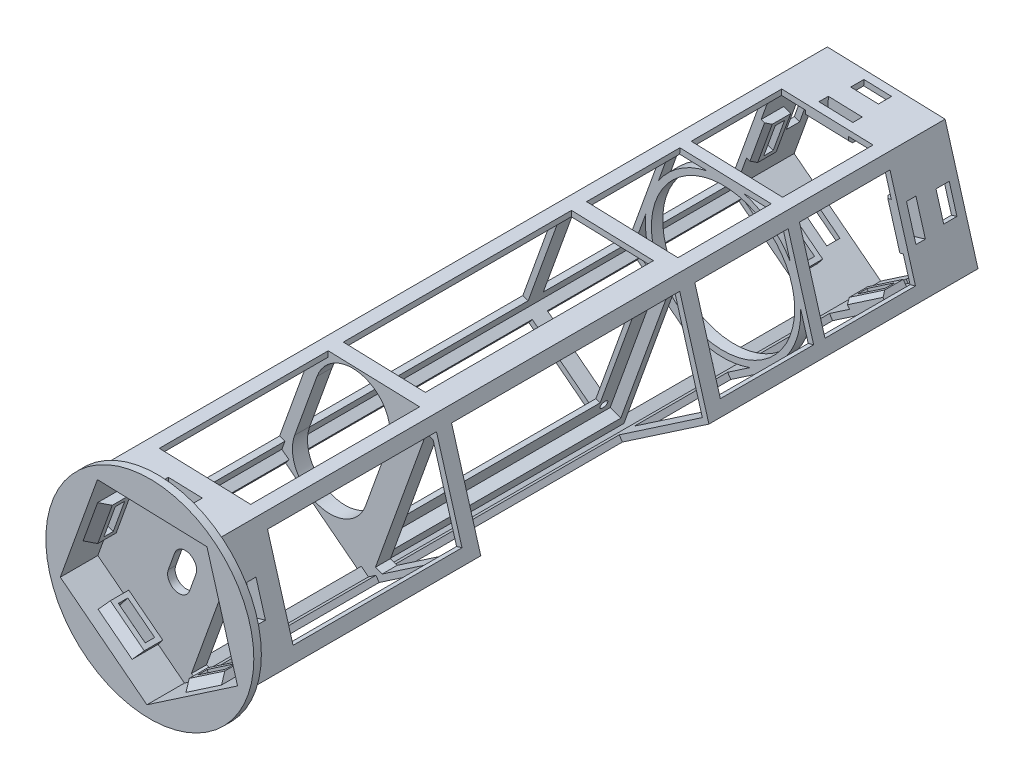
from build123d import *

# Parameters (mm, degrees)
BOSS_EXTRUDE2_DEPTH             = 190
CUT_EXTRUDE1_REACH              = 179.718
CIRPATTERN1_COUNT               = 5
BOSS_EXTRUDE3_DEPTH             = 32.25
BOSS_EXTRUDE4_DEPTH             = 4
SKETCH8_W                       = 61
SKETCH8_H                       = 41
CUT_EXTRUDE3_DEPTH              = 3
SKETCH9_W                       = 53
SKETCH9_H                       = 33
CUT_EXTRUDE4_DEPTH              = 1.2
BOSS_EXTRUDE5_DEPTH             = 4
SKETCH14_R                      = 19
BOSS_EXTRUDE8_DEPTH             = 3
SKETCH61_R                      = 1
CUT_EXTRUDE22_DEPTH             = 1.2
SKETCH62_R                      = 27.575461516
BOSS_EXTRUDE16_DEPTH            = 2
CUT_EXTRUDE23_REACH             = 200.998
SKETCH64_W                      = 2.5
SKETCH64_H                      = 9
SKETCH68_W                      = 4.9
SKETCH68_H                      = 11.4
SKETCH68_W_2                    = 2.5
SKETCH68_H_2                    = 9
BOSS_EXTRUDE19_DEPTH            = 2
CIRPATTERN2_COUNT               = 5
CHAMFER1_SIZE                   = 2
CUT_EXTRUDE14_DEPTH             = 4
BOSS_EXTRUDE17_DEPTH            = 4.6
BOSS_EXTRUDE18_DEPTH            = 8.85
CUT_EXTRUDE24_REACH             = 200.459
SKETCH67_W                      = 3.5
SKETCH67_H                      = 7.344661626
CUT_EXTRUDE24_DIRECTION_2_REACH = 200.459
CIRPATTERN3_COUNT               = 5
BOSS_EXTRUDE20_DEPTH            = 4
CUT_EXTRUDE25_START             = -8.85
CUT_EXTRUDE25_DEPTH             = 8.85
CUT_EXTRUDE2_DEPTH              = 2
CUT_EXTRUDE2_DIRECTION_2_REACH  = 186.811
CUT_EXTRUDE26_REACH             = 188.767
CUT_EXTRUDE27_DEPTH             = 60.5
CUT_EXTRUDE28_DEPTH             = 4


with BuildPart() as part:
    # Sketch3 → Boss-Extrude2 (new body)
    with BuildSketch(Plane.XY):
        Polygon((-0.830733827, -26.562474209), (25.005703315, -8.998330763), (16.285108389, 21.001199955), (-14.94095282, 21.97778614), (-25.519125056, -7.418181123), align=None)
        Polygon((15.148938036, 19.535999959), (-13.898560763, 20.444452223), (-23.738720982, -6.900633603), (-0.772775653, -24.709278334), (23.261119363, -8.370540245), align=None, mode=Mode.SUBTRACT)
    extrude(amount=BOSS_EXTRUDE2_DEPTH)

    # Sketch4 → Cut-Extrude1 (cut, up to next)
    with BuildSketch(Plane(origin=(-20.230038938, 7.279802508, 21.5), x_dir=(-0.11464688926205738, -0.31859532332504725, -0.9409320436343649), z_dir=(0.9409320436343652, -0.3385954655072287, 0)), mode=Mode.PRIVATE) as cut_extrude1_sk1:
        Polygon((-144.092794884, -64.733507296), (13.983788447, -7.849469091), (5.77578447, 14.959973867), (-152.300798861, -41.924064338), align=None)
    cut_extrude1_tool1 = extrude(cut_extrude1_sk1.sketch, amount=CUT_EXTRUDE1_REACH, mode=Mode.PRIVATE) & part.part
    cut_extrude1 = cut_extrude1_tool1.solids().sort_by_distance((-20.230039, 7.279803, 95))[0]
    add(cut_extrude1, mode=Mode.SUBTRACT)

    # CirPattern1: Cut-Extrude1 ×5 about axis
    cirpattern1_axis = Axis((0, 0, 0), (0, 0, 1))
    for i in range(1, CIRPATTERN1_COUNT):
        add(cut_extrude1.rotate(cirpattern1_axis, i * 360 / CIRPATTERN1_COUNT), mode=Mode.SUBTRACT)

    # Sketch5 → Boss-Extrude3 (add, symmetric)
    with BuildSketch(Plane.XY.offset(95)):
        Polygon((-5.559400082, -22.895691232), (10.304256071, 21.188249411), (14.718239264, 21.050203342), (-2.069554109, -25.601847073), align=None)
    extrude(amount=BOSS_EXTRUDE3_DEPTH, both=True)

    # Sketch6 → Boss-Extrude4 (add)
    with BuildSketch(Plane.XY.offset(127.25)):
        Polygon((-25.519125056, -7.418181123), (-0.830733827, -26.562474209), (25.005703315, -8.998330763), (16.285108389, 21.001199955), (-14.94095282, 21.97778614), align=None)
    extrude(amount=BOSS_EXTRUDE4_DEPTH)

    # Sketch8 → Cut-Extrude3 (cut)
    with BuildSketch(Plane(origin=(6.324342577, -2.275821866, 0), x_dir=(0, 0, -1), z_dir=(0.9409320436343654, -0.3385954655072282, 0))):
        with Locations((-95, 0)):
            Rectangle(SKETCH8_W, SKETCH8_H)
    extrude(amount=-CUT_EXTRUDE3_DEPTH, mode=Mode.SUBTRACT)

    # Sketch9 → Cut-Extrude4 (cut)
    with BuildSketch(Plane(origin=(3.501546446, -1.260035469, 0), x_dir=(0, 0, -1), z_dir=(0.9409320436343654, -0.33859546550722847, 0))):
        with Locations((-95, 0)):
            Rectangle(SKETCH9_W, SKETCH9_H)
    extrude(amount=-CUT_EXTRUDE4_DEPTH, mode=Mode.SUBTRACT)

    # Sketch10 → Boss-Extrude5 (add)
    with BuildSketch(Plane(origin=(0, 0, 62.75), x_dir=(-1, 0, 0), z_dir=(0, 0, -1))):
        Polygon((0.830733827, -26.562474209), (25.519125056, -7.418181123), (14.94095282, 21.97778614), (-16.285108389, 21.001199955), (-25.005703315, -8.998330763), align=None)
        Polygon((-23.261119363, -8.370540245), (0.772775653, -24.709278334), (23.738720982, -6.900633603), (13.898560763, 20.444452223), (-15.148938036, 19.535999959), align=None, mode=Mode.SUBTRACT)
    extrude(amount=-BOSS_EXTRUDE5_DEPTH)

    # Sketch14 → Boss-Extrude8 (add)
    with BuildSketch(Plane.XY.offset(35)):
        Polygon((-0.830733827, -26.562474209), (25.005703315, -8.998330763), (16.285108389, 21.001199955), (-14.94095282, 21.97778614), (-25.519125056, -7.418181123), align=None)
        Circle(SKETCH14_R, mode=Mode.SUBTRACT)
        with BuildLine():
            Line((23.261119363, -8.370540245), (15.325878323, -13.765080952))
            ThreePointArc((15.325878323, -13.765080952), (19.383200099, -6.975066589), (20.582730606, 0.843327209))
            Line((20.582730606, 0.843327209), (23.261119363, -8.370540245))
        make_face(mode=Mode.SUBTRACT)
        with BuildLine():
            Line((-0.772775653, -24.709278334), (-8.355413081, -18.829420391))
            ThreePointArc((-8.355413081, -18.829420391), (-0.643944296, -20.589932874), (7.162465386, -19.314737627))
            Line((7.162465386, -19.314737627), (-0.772775653, -24.709278334))
        make_face(mode=Mode.SUBTRACT)
        with BuildLine():
            Line((-23.738720982, -6.900633603), (-20.489807598, 2.127859162))
            ThreePointArc((-20.489807598, 2.127859162), (-19.78117956, -5.750211753), (-16.156083555, -12.780491547))
            Line((-16.156083555, -12.780491547), (-23.738720982, -6.900633603))
        make_face(mode=Mode.SUBTRACT)
        with BuildLine():
            Line((-13.898560763, 20.444452223), (-4.307984437, 20.144509676))
            ThreePointArc((-4.307984437, 20.144509676), (-11.58149701, 17.036106568), (-17.147474148, 11.415959458))
            Line((-17.147474148, 11.415959458), (-13.898560763, 20.444452223))
        make_face(mode=Mode.SUBTRACT)
        with BuildLine():
            Line((15.148938036, 19.535999959), (17.827326792, 10.322132504))
            ThreePointArc((17.827326792, 10.322132504), (12.623420767, 16.279104648), (5.55836171, 19.835942506))
            Line((5.55836171, 19.835942506), (15.148938036, 19.535999959))
        make_face(mode=Mode.SUBTRACT)
    extrude(amount=BOSS_EXTRUDE8_DEPTH)

    # Sketch61 → Cut-Extrude22 (cut)
    with BuildSketch(Plane(origin=(3.501546446, -1.260035469, 0), x_dir=(0, 0, -1), z_dir=(0.9409320436343656, -0.3385954655072283, 0))):
        with Locations(Location((-123, -18, 0), (0, 0, 90))):
            Circle(SKETCH61_R)
        with Locations(Location((-67, -18, 0), (0, 0, 90))):
            Circle(SKETCH61_R)
        with Locations(Location((-123, 18.5, 0), (0, 0, 90))):
            Circle(SKETCH61_R)
        with Locations(Location((-67, 18.5, 0), (0, 0, 90))):
            Circle(SKETCH61_R)
    extrude(amount=-CUT_EXTRUDE22_DEPTH, mode=Mode.SUBTRACT)

    # Sketch62 → Boss-Extrude16 (add)
    with BuildSketch(Plane.XY.offset(190)):
        Circle(SKETCH62_R)
        Polygon((23.261119363, -8.370540245), (15.148938036, 19.535999959), (-13.898560763, 20.444452223), (-23.738720982, -6.900633603), (-0.772775653, -24.709278334), align=None, mode=Mode.SUBTRACT)
    extrude(amount=-BOSS_EXTRUDE16_DEPTH)

    # Sketch64 → Cut-Extrude23 (cut, up to next)
    with BuildSketch(Plane(origin=(-20.230038938, 7.279802508, 0), x_dir=(0, 0, 1), z_dir=(-0.9409320436343653, 0.33859546550722874, 0)), mode=Mode.PRIVATE) as cut_extrude23_sk1:
        with Locations((182.5, 0)):
            Rectangle(SKETCH64_W, SKETCH64_H)
    cut_extrude23_tool1 = extrude(cut_extrude23_sk1.sketch, amount=-CUT_EXTRUDE23_REACH, mode=Mode.PRIVATE) & part.part
    # Sketch64 → Cut-Extrude23 (cut, up to next)
    with BuildSketch(Plane(origin=(-20.230038938, 7.279802508, 0), x_dir=(0, 0, 1), z_dir=(-0.9409320436343653, 0.33859546550722874, 0)), mode=Mode.PRIVATE) as cut_extrude23_sk2:
        with Locations((7.5, 0)):
            Rectangle(SKETCH64_W, SKETCH64_H)
    cut_extrude23_tool2 = extrude(cut_extrude23_sk2.sketch, amount=-CUT_EXTRUDE23_REACH, mode=Mode.PRIVATE) & part.part
    cut_extrude23_1 = cut_extrude23_tool1.solids().sort_by_distance((-20.230039, 7.279803, 182.5))[0]
    add(cut_extrude23_1, mode=Mode.SUBTRACT)
    cut_extrude23_2 = cut_extrude23_tool2.solids().sort_by_distance((-20.230039, 7.279803, 7.5))[0]
    add(cut_extrude23_2, mode=Mode.SUBTRACT)
    cut_extrude23 = cut_extrude23_1 + cut_extrude23_2  # Cut-Extrude23 as one shape, for the pattern or mirror that repeats it

    # Sketch68 → Boss-Extrude19 (add)
    # profile 1 of 2: a face of its own
    with BuildSketch(Plane(origin=(-18.818640873, 6.77190931, 0), x_dir=(0, 0, -1), z_dir=(0.9409320436343653, -0.3385954655072285, 0))):
        with Locations((-182.5, 0)):
            Rectangle(SKETCH68_W, SKETCH68_H)
        with Locations((-182.5, 0)):
            Rectangle(SKETCH68_W_2, SKETCH68_H_2, mode=Mode.SUBTRACT)
    # profile 2 of 2: a face of its own
    with BuildSketch(Plane(origin=(-18.818640873, 6.77190931, 0), x_dir=(0, 0, -1), z_dir=(0.9409320436343653, -0.3385954655072285, 0))):
        with Locations((-7.5, 0)):
            Rectangle(SKETCH68_W, SKETCH68_H)
        with Locations((-7.5, 0)):
            Rectangle(SKETCH68_W_2, SKETCH68_H_2, mode=Mode.SUBTRACT)
    boss_extrude19 = extrude(amount=BOSS_EXTRUDE19_DEPTH)

    # CirPattern2: Cut-Extrude23, Boss-Extrude19 ×5 about axis
    cirpattern2_axis = Axis((0, 0, 0), (0, 0, 1))
    add([cut_extrude23.rotate(cirpattern2_axis, i * 360 / CIRPATTERN2_COUNT) for i in range(1, CIRPATTERN2_COUNT)], mode=Mode.SUBTRACT)
    add([boss_extrude19.rotate(cirpattern2_axis, i * 360 / CIRPATTERN2_COUNT) for i in range(1, CIRPATTERN2_COUNT)])

    # Chamfer1
    # the kernel refuses this chamfer: 2 mm, written as the material it adds along each edge
    with BuildSketch(Plane(origin=(-20.748635026, 1.408596661, 184.95), x_dir=(-0.025871751370717226, 0.009309979140490754, 0.9996219169112968), z_dir=(0.3385954655072285, 0.9409320436343653, 0))) as chamfer1_piece_1_section:
        Polygon((CHAMFER1_SIZE * 0.999621916911, CHAMFER1_SIZE * 0.0274958766106), (-CHAMFER1_SIZE * 0.0274958766106, CHAMFER1_SIZE * 0.999621916911), (0, 0), align=None)
    chamfer1_piece_1 = extrude(amount=11.4, mode=Mode.PRIVATE)
    chamfer1_piece_1 = split(chamfer1_piece_1, bisect_by=Plane(origin=(-16.936776785, 6.094718379, 185.610808309), z_dir=(-0.9409320436343653, 0.3385954655072285, 0)), keep=Keep.TOP, mode=Mode.PRIVATE)
    add(chamfer1_piece_1)
    with BuildSketch(Plane(origin=(-20.748635026, 1.408596661, 9.95), x_dir=(0.9405762931410483, -0.33846744828780867, -0.027495876610586497), z_dir=(0.3385954655072285, 0.9409320436343653, 0))) as chamfer1_piece_2_section:
        Polygon((CHAMFER1_SIZE * 0.999621916911, -CHAMFER1_SIZE * 0.0274958766106), (-CHAMFER1_SIZE * 0.0274958766106, -CHAMFER1_SIZE * 0.999621916911), (0, 0), align=None)
    chamfer1_piece_2 = extrude(amount=11.4, mode=Mode.PRIVATE)
    chamfer1_piece_2 = split(chamfer1_piece_2, bisect_by=Plane(origin=(-18.089950771, 6.509689349, 11), z_dir=(0, 0, -1)), keep=Keep.TOP, mode=Mode.PRIVATE)
    chamfer1_piece_2 = split(chamfer1_piece_2, bisect_by=Plane(origin=(-16.936776785, 6.094718379, 10.385865586), z_dir=(-0.9409320436343653, 0.3385954655072285, 0)), keep=Keep.TOP, mode=Mode.PRIVATE)
    add(chamfer1_piece_2)
    with BuildSketch(Plane(origin=(-5.072025799, 20.168404852, 184.95), x_dir=(0.0008595054803406778, 0.02748243950077503, 0.9996219169112968), z_dir=(0.999511304549409, -0.03125943182367236, 0))) as chamfer1_piece_3_section:
        Polygon((CHAMFER1_SIZE * 0.999621916911, CHAMFER1_SIZE * 0.0274958766106), (-CHAMFER1_SIZE * 0.0274958766106, CHAMFER1_SIZE * 0.999621916911), (0, 0), align=None)
    chamfer1_piece_3 = extrude(amount=11.4, mode=Mode.PRIVATE)
    chamfer1_piece_3 = split(chamfer1_piece_3, bisect_by=Plane(origin=(0.562669773, 17.991203482, 185.610808309), z_dir=(0.03125943182367236, 0.999511304549409, 0)), keep=Keep.TOP, mode=Mode.PRIVATE)
    add(chamfer1_piece_3)
    with BuildSketch(Plane(origin=(-5.072025799, 20.168404852, 9.95), x_dir=(0.0008595054803406741, 0.027482439500774912, 0.9996219169112968), z_dir=(0.999511304549409, -0.03125943182367236, 0))) as chamfer1_piece_4_section:
        Polygon((CHAMFER1_SIZE * 0.999621916911, CHAMFER1_SIZE * 0.0274958766106), (-CHAMFER1_SIZE * 0.0274958766106, CHAMFER1_SIZE * 0.999621916911), (0, 0), align=None)
    chamfer1_piece_4 = extrude(amount=11.4, mode=Mode.PRIVATE)
    chamfer1_piece_4 = split(chamfer1_piece_4, bisect_by=Plane(origin=(0.600980258, 19.216170197, 11), z_dir=(0, 0, -1)), keep=Keep.TOP, mode=Mode.PRIVATE)
    chamfer1_piece_4 = split(chamfer1_piece_4, bisect_by=Plane(origin=(0.562669773, 17.991203482, 10.385865586), z_dir=(0.03125943182367236, 0.999511304549409, 0)), keep=Keep.TOP, mode=Mode.PRIVATE)
    add(chamfer1_piece_4)
    with BuildSketch(Plane(origin=(17.61395069, 11.056163036, 184.95), x_dir=(0.026402954971085378, 0.007675102564752102, 0.9996219169112968), z_dir=(0.2791364928440535, -0.9602514349704049, 0))) as chamfer1_piece_5_section:
        Polygon((CHAMFER1_SIZE * 0.999621916911, CHAMFER1_SIZE * 0.0274958766106), (-CHAMFER1_SIZE * 0.0274958766106, CHAMFER1_SIZE * 0.999621916911), (0, 0), align=None)
    chamfer1_piece_5 = extrude(amount=11.4, mode=Mode.PRIVATE)
    chamfer1_piece_5 = split(chamfer1_piece_5, bisect_by=Plane(origin=(17.284525829, 5.024456871, 185.610808309), z_dir=(0.9602514349704049, 0.2791364928440535, 0)), keep=Keep.TOP, mode=Mode.PRIVATE)
    add(chamfer1_piece_5)
    with BuildSketch(Plane(origin=(17.61395069, 11.056163036, 9.95), x_dir=(0.026402954971086856, 0.007675102564752532, 0.9996219169112968), z_dir=(0.2791364928440535, -0.9602514349704049, 0))) as chamfer1_piece_6_section:
        Polygon((CHAMFER1_SIZE * 0.999621916911, CHAMFER1_SIZE * 0.0274958766106), (-CHAMFER1_SIZE * 0.0274958766106, CHAMFER1_SIZE * 0.999621916911), (0, 0), align=None)
    chamfer1_piece_6 = extrude(amount=11.4, mode=Mode.PRIVATE)
    chamfer1_piece_6 = split(chamfer1_piece_6, bisect_by=Plane(origin=(18.461376997, 5.366556967, 11), z_dir=(0, 0, -1)), keep=Keep.TOP, mode=Mode.PRIVATE)
    chamfer1_piece_6 = split(chamfer1_piece_6, bisect_by=Plane(origin=(17.284525829, 5.024456871, 10.385865586), z_dir=(0.9602514349704049, 0.2791364928440535, 0)), keep=Keep.TOP, mode=Mode.PRIVATE)
    add(chamfer1_piece_6)
    with BuildSketch(Plane(origin=(15.958046002, -13.335320311, 184.95), x_dir=(0.015458418095223471, -0.022738965248619798, 0.9996219169112968), z_dir=(-0.826995464471342, -0.5622085927338973, 0))) as chamfer1_piece_7_section:
        Polygon((CHAMFER1_SIZE * 0.999621916911, CHAMFER1_SIZE * 0.0274958766106), (-CHAMFER1_SIZE * 0.0274958766106, CHAMFER1_SIZE * 0.999621916911), (0, 0), align=None)
    chamfer1_piece_7 = extrude(amount=11.4, mode=Mode.PRIVATE)
    chamfer1_piece_7 = split(chamfer1_piece_7, bisect_by=Plane(origin=(10.119754669, -14.88591836, 185.610808309), z_dir=(0.5622085927338974, -0.8269954644713422, 0)), keep=Keep.TOP, mode=Mode.PRIVATE)
    add(chamfer1_piece_7)
    with BuildSketch(Plane(origin=(15.958046002, -13.335320311, 9.95), x_dir=(0.015458418095223532, -0.02273896524861989, 0.9996219169112968), z_dir=(-0.826995464471342, -0.5622085927338973, 0))) as chamfer1_piece_8_section:
        Polygon((CHAMFER1_SIZE * 0.999621916911, CHAMFER1_SIZE * 0.0274958766106), (-CHAMFER1_SIZE * 0.0274958766106, CHAMFER1_SIZE * 0.999621916911), (0, 0), align=None)
    chamfer1_piece_8 = extrude(amount=11.4, mode=Mode.PRIVATE)
    chamfer1_piece_8 = split(chamfer1_piece_8, bisect_by=Plane(origin=(10.808778205, -15.899455589, 11), z_dir=(0, 0, -1)), keep=Keep.TOP, mode=Mode.PRIVATE)
    chamfer1_piece_8 = split(chamfer1_piece_8, bisect_by=Plane(origin=(10.119754669, -14.88591836, 10.385865586), z_dir=(0.5622085927338974, -0.8269954644713422, 0)), keep=Keep.TOP, mode=Mode.PRIVATE)
    add(chamfer1_piece_8)
    with BuildSketch(Plane(origin=(-7.751335867, -19.297844239, 184.95), x_dir=(-0.01684912717593206, -0.0217285559574026, 0.9996219169112968), z_dir=(-0.790247798429349, 0.6127874158936091, 0))) as chamfer1_piece_9_section:
        Polygon((CHAMFER1_SIZE * 0.999621916911, CHAMFER1_SIZE * 0.0274958766106), (-CHAMFER1_SIZE * 0.0274958766106, CHAMFER1_SIZE * 0.999621916911), (0, 0), align=None)
    chamfer1_piece_9 = extrude(amount=11.4, mode=Mode.PRIVATE)
    chamfer1_piece_9 = split(chamfer1_piece_9, bisect_by=Plane(origin=(-11.030173486, -14.224460372, 185.610808309), z_dir=(-0.6127874158936091, -0.790247798429349, 0)), keep=Keep.TOP, mode=Mode.PRIVATE)
    add(chamfer1_piece_9)
    with BuildSketch(Plane(origin=(-7.751335867, -19.297844239, 9.95), x_dir=(-0.016849127175932312, -0.021728555957402928, 0.9996219169112968), z_dir=(-0.790247798429349, 0.6127874158936091, 0))) as chamfer1_piece_10_section:
        Polygon((CHAMFER1_SIZE * 0.999621916911, CHAMFER1_SIZE * 0.0274958766106), (-CHAMFER1_SIZE * 0.0274958766106, CHAMFER1_SIZE * 0.999621916911), (0, 0), align=None)
    chamfer1_piece_10 = extrude(amount=11.4, mode=Mode.PRIVATE)
    chamfer1_piece_10 = split(chamfer1_piece_10, bisect_by=Plane(origin=(-11.78118469, -15.192960923, 11), z_dir=(0, 0, -1)), keep=Keep.TOP, mode=Mode.PRIVATE)
    chamfer1_piece_10 = split(chamfer1_piece_10, bisect_by=Plane(origin=(-11.030173486, -14.224460372, 10.385865586), z_dir=(-0.6127874158936091, -0.790247798429349, 0)), keep=Keep.TOP, mode=Mode.PRIVATE)
    add(chamfer1_piece_10)

    # Sketch38 → Cut-Extrude14 (cut)
    with BuildSketch(Plane(origin=(0, 0, 127.25), x_dir=(-1, 0, 0), z_dir=(0, 0, -1))):
        Polygon((-16.373759649, 15.322517515), (-23.261119363, -8.370540245), (-2.855993587, -22.242366077), (-1.070950816, -21.600016406), (-14.588716878, 15.964867186), align=None)
    extrude(amount=-CUT_EXTRUDE14_DEPTH, mode=Mode.SUBTRACT)

    # Sketch65 → Boss-Extrude17 (add)
    with BuildSketch(Plane(origin=(0, 0, 0), x_dir=(-1, 0, 0), z_dir=(0, 0, -1))):
        Polygon((0.830733827, -26.562474209), (25.519125056, -7.418181123), (14.94095282, 21.97778614), (-16.285108389, 21.001199955), (-25.005703315, -8.998330763), align=None)
        Polygon((23.738720982, -6.900633603), (0.772775653, -24.709278334), (-23.261119363, -8.370540245), (-15.148938036, 19.535999959), (13.898560763, 20.444452223), align=None, mode=Mode.SUBTRACT)
    extrude(amount=BOSS_EXTRUDE17_DEPTH)

    # Sketch66 → Boss-Extrude18 (add)
    with BuildSketch(Plane(origin=(0, 0, -4.6), x_dir=(-1, 0, 0), z_dir=(0, 0, -1))):
        Polygon((-16.029362684, -13.286837758), (-20.82017829, 0.02648855), (-21.580010876, -2.58739516), (-18.280512637, -11.756459538), align=None)
    boss_extrude18 = extrude(amount=-BOSS_EXTRUDE18_DEPTH)

    # Sketch67 → Cut-Extrude24 (cut, up to next)
    with BuildSketch(Plane(origin=(18.424770487, -6.630174604, 0), x_dir=(0, 0, 1), z_dir=(-0.9409320436343654, 0.33859546550722813, 0)), mode=Mode.PRIVATE) as cut_extrude24_sk1:
        with Locations((-0.6, 0)):
            Rectangle(SKETCH67_W, SKETCH67_H)
    cut_extrude24_tool1 = extrude(cut_extrude24_sk1.sketch, amount=-CUT_EXTRUDE24_REACH, mode=Mode.PRIVATE) & part.part
    cut_extrude24 = cut_extrude24_tool1.solids().sort_by_distance((18.42477, -6.630175, -0.6))[0]
    add(cut_extrude24, mode=Mode.SUBTRACT)

    # Sketch67 → Cut-Extrude24 direction 2 (cut, up to next)
    with BuildSketch(Plane(origin=(18.424770487, -6.630174604, 0), x_dir=(0, 0, 1), z_dir=(-0.9409320436343654, 0.33859546550722813, 0)), mode=Mode.PRIVATE) as cut_extrude24_direction_2_sk1:
        with Locations((-0.6, 0)):
            Rectangle(SKETCH67_W, SKETCH67_H)
    cut_extrude24_direction_2_tool1 = extrude(cut_extrude24_direction_2_sk1.sketch, amount=CUT_EXTRUDE24_DIRECTION_2_REACH, mode=Mode.PRIVATE) & part.part
    cut_extrude24_direction_2 = cut_extrude24_direction_2_tool1.solids().sort_by_distance((18.42477, -6.630175, -0.6))[0]
    add(cut_extrude24_direction_2, mode=Mode.SUBTRACT)

    # CirPattern3: Boss-Extrude18, Cut-Extrude24, Cut-Extrude24 direction 2 ×5 about axis
    cirpattern3_axis = Axis((0, 0, 0), (0, 0, 1))
    add([boss_extrude18.rotate(cirpattern3_axis, i * 360 / CIRPATTERN3_COUNT) for i in range(1, CIRPATTERN3_COUNT)])
    add([cut_extrude24.rotate(cirpattern3_axis, i * 360 / CIRPATTERN3_COUNT) for i in range(1, CIRPATTERN3_COUNT)], mode=Mode.SUBTRACT)
    add([cut_extrude24_direction_2.rotate(cirpattern3_axis, i * 360 / CIRPATTERN3_COUNT) for i in range(1, CIRPATTERN3_COUNT)], mode=Mode.SUBTRACT)

    # Sketch71 → Boss-Extrude20 (add)
    with BuildSketch(Plane(origin=(0, 0, 180.05), x_dir=(-1, 0, 0), z_dir=(0, 0, -1))):
        Polygon((0.830733827, -26.562474209), (25.519125056, -7.418181123), (14.94095282, 21.97778614), (-16.285108389, 21.001199955), (-25.005703315, -8.998330763), align=None)
    extrude(amount=BOSS_EXTRUDE20_DEPTH)

    # Sketch69 → Cut-Extrude25 (cut)
    with BuildSketch(Plane(origin=(0, 0, -4.6), x_dir=(-1, 0, 0), z_dir=(0, 0, -1)).offset(CUT_EXTRUDE25_START)):
        Polygon((-15.148938036, 19.535999959), (-23.261119363, -8.370540245), (0.772775653, -24.709278334), (23.738720982, -6.900633603), (13.898560763, 20.444452223), align=None)
    extrude(amount=CUT_EXTRUDE25_DEPTH, mode=Mode.SUBTRACT)

    # Sketch7 → Cut-Extrude2 (cut)
    with BuildSketch(Plane(origin=(0, 0, 176.05), x_dir=(-1, 0, 0), z_dir=(0, 0, -1))):
        with BuildLine():
            Line((20.349855245, -1.976371517), (14.424434599, 14.489939247))
            ThreePointArc((14.424434599, 14.489939247), (1.629159508, 20.513305028), (-4.394206274, 7.718029937))
            Line((-4.394206274, 7.718029937), (1.531214373, -8.748280827))
            ThreePointArc((1.531214373, -8.748280827), (14.326489464, -14.771646608), (20.349855245, -1.976371517))
        make_face()
    extrude(amount=-CUT_EXTRUDE2_DEPTH, mode=Mode.SUBTRACT)

    # Sketch7 → Cut-Extrude2 direction 2 (cut, up to next)
    with BuildSketch(Plane(origin=(0, 0, 176.05), x_dir=(-1, 0, 0), z_dir=(0, 0, -1)), mode=Mode.PRIVATE) as cut_extrude2_direction_2_sk1:
        with BuildLine():
            Line((20.349855245, -1.976371517), (14.424434599, 14.489939247))
            ThreePointArc((14.424434599, 14.489939247), (1.629159508, 20.513305028), (-4.394206274, 7.718029937))
            Line((-4.394206274, 7.718029937), (1.531214373, -8.748280827))
            ThreePointArc((1.531214373, -8.748280827), (14.326489464, -14.771646608), (20.349855245, -1.976371517))
        make_face()
    cut_extrude2_direction_2_tool1 = extrude(cut_extrude2_direction_2_sk1.sketch, amount=CUT_EXTRUDE2_DIRECTION_2_REACH, mode=Mode.PRIVATE) & part.part
    add(cut_extrude2_direction_2_tool1.solids().sort_by_distance((-7.977824, 2.870829, 176.05))[0], mode=Mode.SUBTRACT)

    # Sketch49 → Cut-Extrude26 (cut, up to next)
    with BuildSketch(Plane(origin=(0, 0, 178.05), x_dir=(-1, 0, 0), z_dir=(0, 0, -1)), mode=Mode.PRIVATE) as cut_extrude26_sk1:
        with BuildLine():
            Line((3.367607648, 3.868777457), (5.060584975, -0.835882761))
            ThreePointArc((5.060584975, -0.835882761), (3.253575241, -4.674465289), (-0.585007287, -2.867455554))
            Line((-0.585007287, -2.867455554), (-2.277984614, 1.837204664))
            ThreePointArc((-2.277984614, 1.837204664), (-0.47097488, 5.675787191), (3.367607648, 3.868777457))
        make_face()
    cut_extrude26_tool1 = extrude(cut_extrude26_sk1.sketch, amount=-CUT_EXTRUDE26_REACH, mode=Mode.PRIVATE) & part.part
    add(cut_extrude26_tool1.solids().sort_by_distance((-1.3913, 0.500661, 178.05))[0], mode=Mode.SUBTRACT)

    # Sketch70 → Cut-Extrude27 (cut)
    with BuildSketch(Plane(origin=(0, 0, 127.25), x_dir=(-1, 0, 0), z_dir=(0, 0, -1))):
        Polygon((-24.02872559, -5.637450741), (-22.588348438, -6.05615548), (-21.2679063, -9.725567641), (-22.111219189, -10.966060838), (-25.005703315, -8.998330763), align=None)
    extrude(amount=CUT_EXTRUDE27_DEPTH, mode=Mode.SUBTRACT)

    # Sketch72 → Cut-Extrude28 (cut)
    with BuildSketch(Plane(origin=(0, 0, 176.05), x_dir=(-1, 0, 0), z_dir=(0, 0, -1))):
        Polygon((-16.373759649, 15.322517515), (-23.261119363, -8.370540245), (-2.855993587, -22.242366077), (-1.070950816, -21.600016406), (-14.588716878, 15.964867186), align=None)
    extrude(amount=-CUT_EXTRUDE28_DEPTH, mode=Mode.SUBTRACT)


solid = part.part
